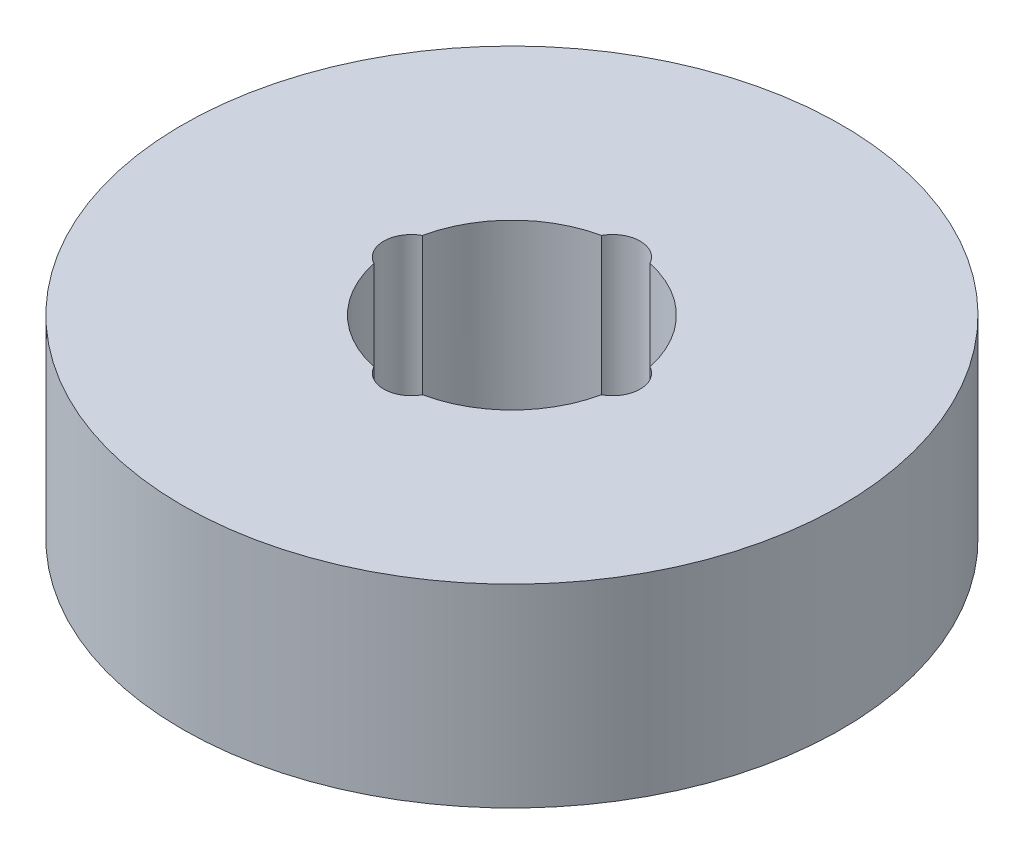
from build123d import *

# Parameters (mm, degrees)
SKETCH1_R           = 42.5
BOSS_EXTRUDE1_DEPTH = 25
SKETCH2_R           = 15
CUT_EXTRUDE1_DEPTH  = 66.096082831
SKETCH3_R           = 3.558946245
CUT_EXTRUDE2_DEPTH  = 22.550205578
CIRPATTERN1_COUNT   = 4


with BuildPart() as part:
    # Sketch1 → Boss-Extrude1 (new body)
    with BuildSketch(Plane(origin=(0, 0, 0), x_dir=(1, 0, 0), z_dir=(0, 1, 0))):
        Circle(SKETCH1_R)
    extrude(amount=BOSS_EXTRUDE1_DEPTH)

    # Sketch2 → Cut-Extrude1 (cut, through all)
    with BuildSketch(Plane(origin=(0, 0, 0), x_dir=(1, 0, 0), z_dir=(0, 1, 0))):
        Circle(SKETCH2_R)
    extrude(amount=CUT_EXTRUDE1_DEPTH, mode=Mode.SUBTRACT)

    # Sketch3 → Cut-Extrude2 (cut)
    with BuildSketch(Plane(origin=(0, 25, 0), x_dir=(1, 0, 0), z_dir=(0, 1, 0))):
        with Locations((-12.974475633, 0)):
            Circle(SKETCH3_R)
    cut_extrude2 = extrude(amount=-CUT_EXTRUDE2_DEPTH, mode=Mode.SUBTRACT)

    # CirPattern1: Cut-Extrude2 ×4 about axis
    cirpattern1_axis = Axis((0, 0, 0), (0, 1, 0))
    for i in range(1, CIRPATTERN1_COUNT):
        add(cut_extrude2.rotate(cirpattern1_axis, i * 360 / CIRPATTERN1_COUNT), mode=Mode.SUBTRACT)


solid = part.part
